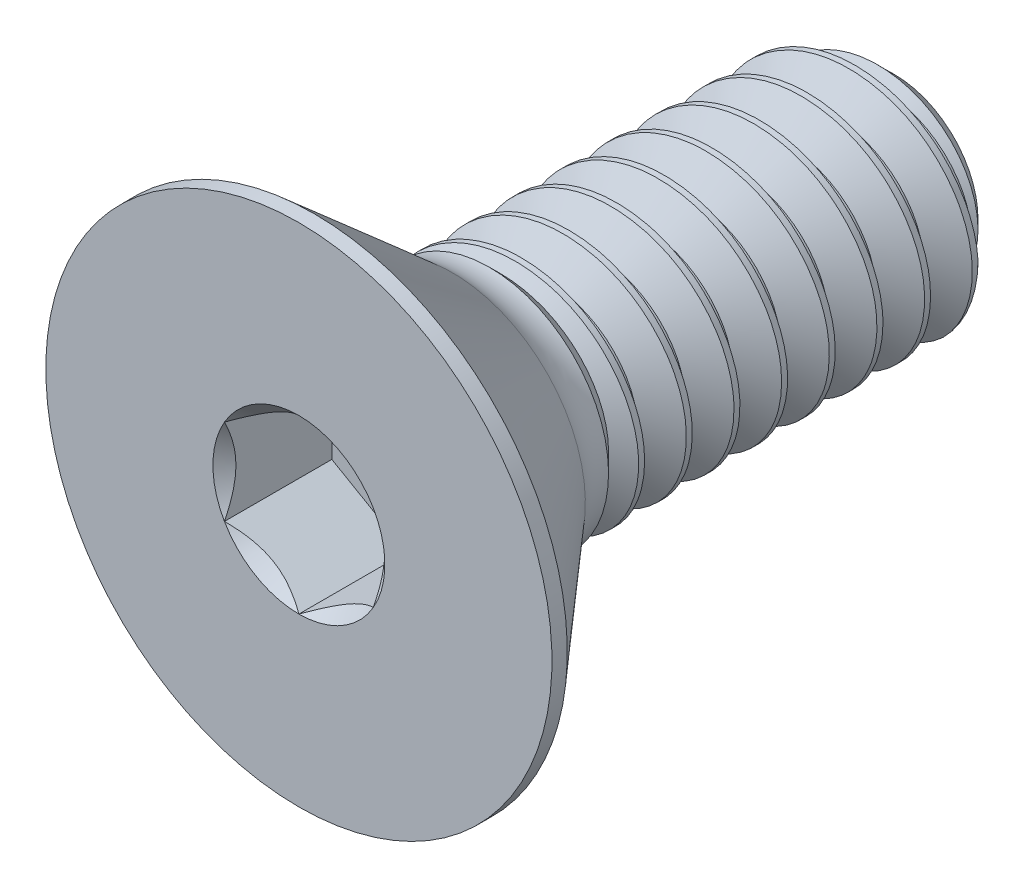
from build123d import *
from build123d.topology import SkipClean

# Parameters (mm, degrees)
SKETCH1_W          = 15.875
SKETCH1_H          = 3.175
CHAMFER1_SIZE      = 0.9525
CUT_SWEEP1_PITCH   = 1.27
CUT_EXTRUDE2_DEPTH = 2.86258


with BuildPart() as part:
    # Sketch1 → Revolve1 (revolve)
    with BuildSketch(Plane(origin=(0, 0, 0), x_dir=(0, 0, -1), z_dir=(1, 0, 0))):
        with Locations((7.9375, 1.5875)):
            Rectangle(SKETCH1_W, SKETCH1_H)
    revolve(axis=Axis((0, 0, -15.875), (0, 0, 1)))

    # Chamfer1
    chamfer1_edges = [part.edges().sort_by_distance(p)[0] for p in [
        (0, -3.175, -15.875),
    ]]
    chamfer(chamfer1_edges, length=CHAMFER1_SIZE)

    # Cut-Sweep1: the profile of Sketch2 profile screwed along a right-hand helix of 12.5 turns, 8 arcs to a turn; built about Z, then put on its axis
    with SkipClean():  # the faces are left unmerged after this step: merging them gives an invalid solid
        cut_sweep1_z = Axis((0, 0, 0), (0, 0, 1))
        cut_sweep1_corners = [(3.1756, 0, 0.00034641), (3.1756, 0, -1.11159641), (2.350110803, 0, -0.635), (2.350110803, 0, -0.47625)]
        with BuildLine(mode=Mode.PRIVATE) as cut_sweep1_profile:
            Line(cut_sweep1_corners[0], cut_sweep1_corners[1])
            Line(cut_sweep1_corners[1], cut_sweep1_corners[2])
            Line(cut_sweep1_corners[2], cut_sweep1_corners[3])
            Line(cut_sweep1_corners[3], cut_sweep1_corners[0])
        cut_sweep1_cap = Face(cut_sweep1_profile.wire())
        cut_sweep1_turn_angles = [0, 22.5, 45, 67.5, 90, 112.5, 135, 157.5, 180, 202.5, 225, 247.5, 270, 292.5, 315, 337.5, 360]
        cut_sweep1_turn_weights = [1, 0.9238795325112867, 1, 0.9238795325112867, 1, 0.9238795325112867, 1, 0.9238795325112867, 1, 0.9238795325112867, 1, 0.9238795325112867, 1, 0.9238795325112867, 1, 0.9238795325112867, 1]
        cut_sweep1_turn_rails = [Edge.make_bspline([Vector(p[0], p[1], 0).rotate(cut_sweep1_z, cut_sweep1_turn_angles[k]) / cut_sweep1_turn_weights[k] + Vector(0, 0, p[2] + CUT_SWEEP1_PITCH * cut_sweep1_turn_angles[k] / 360) for k in range(17)], [0, 0, 0, 1, 1, 2, 2, 3, 3, 4, 4, 5, 5, 6, 6, 7, 7, 8, 8, 8], 2, cut_sweep1_turn_weights) for p in cut_sweep1_corners]
        cut_sweep1_turn_sides = [Face.make_surface_from_curves(cut_sweep1_turn_rails[p[0]], cut_sweep1_turn_rails[p[1]]) for p in [(0, 1), (1, 2), (2, 3), (3, 0)]]
        cut_sweep1_last_angles = [4320, 4342.5, 4365, 4387.5, 4410, 4432.5, 4455, 4477.5, 4500]
        cut_sweep1_last_weights = [1, 0.9238795325112867, 1, 0.9238795325112867, 1, 0.9238795325112867, 1, 0.9238795325112564, 1]
        cut_sweep1_last_rails = [Edge.make_bspline([Vector(p[0], p[1], 0).rotate(cut_sweep1_z, cut_sweep1_last_angles[k]) / cut_sweep1_last_weights[k] + Vector(0, 0, p[2] + CUT_SWEEP1_PITCH * cut_sweep1_last_angles[k] / 360) for k in range(9)], [0, 0, 0, 1, 1, 2, 2, 3, 3, 4, 4, 4], 2, cut_sweep1_last_weights) for p in cut_sweep1_corners]
        cut_sweep1_last_sides = [Face.make_surface_from_curves(cut_sweep1_last_rails[p[0]], cut_sweep1_last_rails[p[1]]) for p in [(0, 1), (1, 2), (2, 3), (3, 0)]]
        cut_sweep1 = Plane(origin=(0, 0, -15.875), x_dir=(0, 1, 0), z_dir=(0, 0, 1)) * Solid(Shell([*[p.moved(Location((0, 0, CUT_SWEEP1_PITCH * i))) for i in range(12) for p in cut_sweep1_turn_sides], *cut_sweep1_last_sides, cut_sweep1_cap, cut_sweep1_cap.rotate(cut_sweep1_z, 4500).moved(Location((0, 0, CUT_SWEEP1_PITCH * 4500 / 360)))]))
        add(cut_sweep1, mode=Mode.SUBTRACT)


with BuildPart() as body_2:
    # Sketch7 → Revolve2 (revolve)
    with BuildSketch(Plane(origin=(0, 0, 0), x_dir=(0, 0, -1), z_dir=(1, 0, 0)), mode=Mode.PRIVATE) as revolve2_sk:
        with BuildLine():
            Line((0, 6.7437), (0.40894, 6.7437))
            Line((0.40894, 6.7437), (4.0894, 3.544324933))
            ThreePointArc((4.0894, 3.544324933), (4.549909788, 3.270350399), (5.077204404, 3.175))
            Line((5.077204404, 3.175), (5.077204404, 0))
            Line((5.077204404, 0), (0, 0))
            Line((0, 0), (0, 6.7437))
        make_face()
    revolve(revolve2_sk.sketch.rotate(Axis((0, 0, 0), (0, 0, -1)), 180), axis=Axis((0, 0, 0), (0, 0, -1)))

    # Boss-Extrude1 cone 1 section (through the dimple's axis) → Boss-Extrude1 (revolve)
    with BuildSketch(Plane(origin=(0, 0, -5.077204404), x_dir=(0, -1, 0), z_dir=(1, 0, 0))):
        Polygon((0, 0), (3.175, 0), (0, 3.175), align=None)
    revolve(axis=Axis((0, 0, -5.077204404), (0, 0, -1)))

    # Combine1: union part
    add(part.part)

    # Sketch5 → Cut-Extrude2 (cut)
    with BuildSketch(Plane.XY):
        Polygon((1.984375, -1.14567944), (1.984375, 1.14567944), (0, 2.291358881), (-1.984375, 1.14567944), (-1.984375, -1.14567944), (0, -2.291358881), align=None)
    extrude(amount=-CUT_EXTRUDE2_DEPTH, mode=Mode.SUBTRACT)

    # Cut-Extrude3 cone 1 section (through the dimple's axis) → Cut-Extrude3 (revolve, cut)
    with BuildSketch(Plane(origin=(0, 0, 0), x_dir=(0, -1, 0), z_dir=(1, 0, 0))):
        Polygon((0, 0), (2.291358881, 0), (0, 2.291358881), align=None)
    revolve(axis=Axis((0, 0, 0), (0, 0, -1)), mode=Mode.SUBTRACT)


solid = body_2.part
